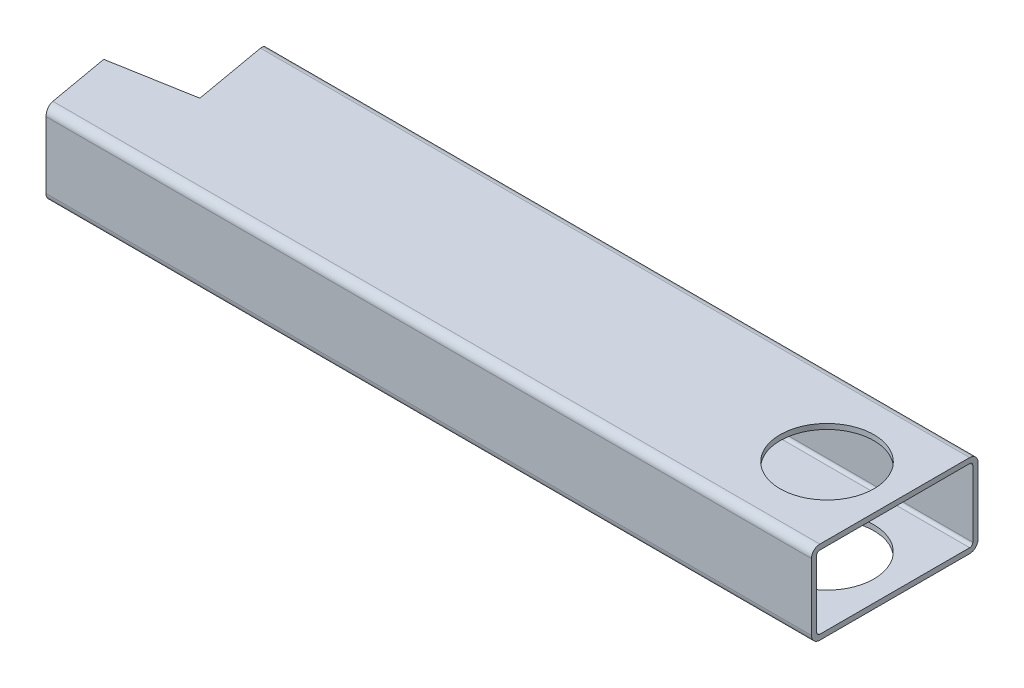
from build123d import *

# Parameters (mm, degrees)
EXTRUDE_THIN1_DEPTH     = 243.6368
CUT_EXTRUDE1_DEPTH      = 251.169323288
CUT_EXTRUDE1_DEPTH_BACK = 251.169323288
SKETCH4_R               = 14.3129


with BuildPart() as part:
    # Sketch1 → Extrude-Thin1 (new body)
    with BuildSketch(Plane(origin=(0, 0, 0), x_dir=(0, 0, -1), z_dir=(1, 0, 0))):
        with BuildLine():
            Line((-48.26, 25.4), (-2.54, 25.4))
            ThreePointArc((-2.54, 25.4), (-0.743948776, 24.656051224), (0, 22.86))
            Line((0, 22.86), (0, 2.54))
            ThreePointArc((0, 2.54), (-0.743948776, 0.743948776), (-2.54, 0))
            Line((-2.54, 0), (-48.26, 0))
            ThreePointArc((-48.26, 0), (-50.056051224, 0.743948776), (-50.8, 2.54))
            Line((-50.8, 2.54), (-50.8, 22.86))
            ThreePointArc((-50.8, 22.86), (-50.056051224, 24.656051224), (-48.26, 25.4))
        make_face()
        with BuildLine():
            Line((-48.26, 23.8125), (-2.54, 23.8125))
            ThreePointArc((-2.54, 23.8125), (-1.866480791, 23.533519209), (-1.5875, 22.86))
            Line((-1.5875, 22.86), (-1.5875, 2.54))
            ThreePointArc((-1.5875, 2.54), (-1.866480791, 1.866480791), (-2.54, 1.5875))
            Line((-2.54, 1.5875), (-48.26, 1.5875))
            ThreePointArc((-48.26, 1.5875), (-48.933519209, 1.866480791), (-49.2125, 2.54))
            Line((-49.2125, 2.54), (-49.2125, 22.86))
            ThreePointArc((-49.2125, 22.86), (-48.933519209, 23.533519209), (-48.26, 23.8125))
        make_face(mode=Mode.SUBTRACT)
    extrude(amount=-EXTRUDE_THIN1_DEPTH)

    # Sketch4 → Cut-Extrude1 (cut, two sides: drawn at the far end of the back side and taken through both)
    with BuildSketch(Plane(origin=(0, 25.4, 0), x_dir=(1, 0, 0), z_dir=(0, 1, 0)).offset(-CUT_EXTRUDE1_DEPTH_BACK)):
        with Locations((-20.6629, -25.4)):
            Circle(SKETCH4_R)
        Polygon((-216.779817555, 0), (-212.369153842, -25.014116927), (-237.2868, -29.40777024), (-233.514772716, -50.8), (-243.6368, -50.8), (-243.6368, -30.527446567), (-243.6368, 0), align=None)
    extrude(amount=CUT_EXTRUDE1_DEPTH + CUT_EXTRUDE1_DEPTH_BACK, mode=Mode.SUBTRACT)


solid = part.part
